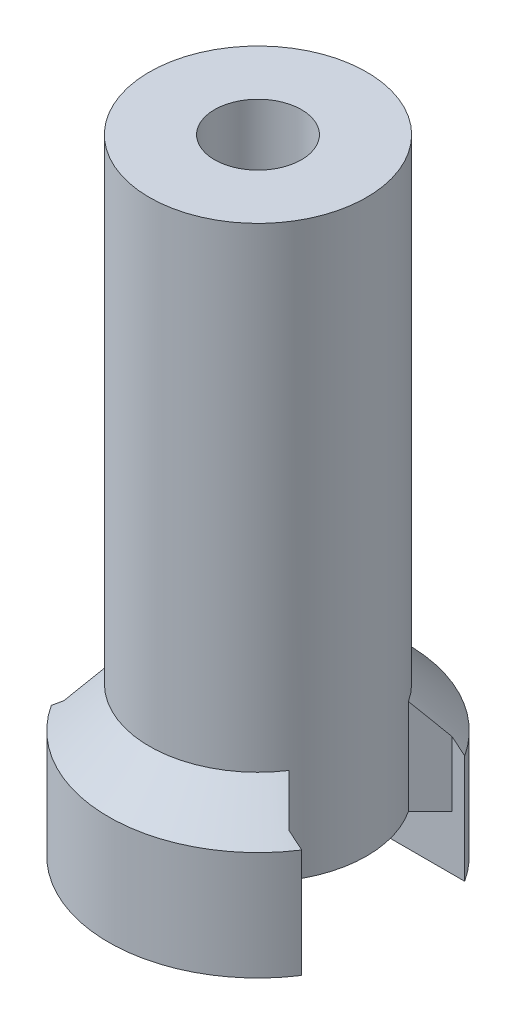
from build123d import *
from OCP.BRepFilletAPI import BRepFilletAPI_MakeChamfer

# Parameters (mm, degrees)
SKETCH1_R           = 4
SKETCH1_R_2         = 1.6
BOSS_EXTRUDE1_DEPTH = 23
SKETCH3_W           = 13.555932204
SKETCH3_H           = 6
SKETCH3_R           = 1.6
CUT_EXTRUDE1_DEPTH  = 2
BOSS_EXTRUDE2_DEPTH = 4
CHAMFER1_SIZE       = 1.5
CHAMFER1_SIZE_2     = 1.062746067


with BuildPart() as part:
    # Sketch1 → Boss-Extrude1 (new body)
    with BuildSketch(Plane(origin=(0, 0, 0), x_dir=(1, 0, 0), z_dir=(0, 1, 0))):
        with Locations(Location((0, 0, 0), (0, 0, 270))):
            Circle(SKETCH1_R)
        with Locations(Location((0, 0, 0), (0, 0, 270))):
            Circle(SKETCH1_R_2, mode=Mode.SUBTRACT)
    extrude(amount=BOSS_EXTRUDE1_DEPTH)

    # Sketch3 → Cut-Extrude1 (cut)
    with BuildSketch(Plane.XZ):
        Rectangle(SKETCH3_W, SKETCH3_H)
        with Locations(Location((0, 0, 0), (0, 0, 270))):
            Circle(SKETCH3_R, mode=Mode.SUBTRACT)
    extrude(amount=-CUT_EXTRUDE1_DEPTH, mode=Mode.SUBTRACT)

    # Sketch5 → Boss-Extrude2 (add)
    with BuildSketch(Plane.XZ):
        with BuildLine():
            Line((-4.609772229, 3), (4.609772229, 3))
            ThreePointArc((4.609772229, 3), (0, 5.5), (-4.609772229, 3))
        make_face()
        with BuildLine():
            Line((4.609772229, -3), (-4.609772229, -3))
            ThreePointArc((-4.609772229, -3), (0, -5.5), (4.609772229, -3))
        make_face()
    extrude(amount=-BOSS_EXTRUDE2_DEPTH)

    # Chamfer1
    chamfer1_edges_1 = [part.edges().sort_by_distance(p)[0] for p in [
        (2.645751311, 3, -3),
    ]]
    chamfer1_side_1 = [part.faces().sort_by_distance(p)[0] for p in [
        (2.667006232, 3, -3),
    ]]
    chamfer1_edges_2 = [part.edges().sort_by_distance(p)[0] for p in [
        (-2.645751311, 3, -3),
    ]]
    chamfer1_side_2 = [part.faces().sort_by_distance(p)[0] for p in [
        (-2.667006232, 3, -3),
    ]]
    chamfer1_edges_3 = [part.edges().sort_by_distance(p)[0] for p in [
        (2.645751311, 3, 3),
    ]]
    chamfer1_side_3 = [part.faces().sort_by_distance(p)[0] for p in [
        (2.667006232, 3, 3),
    ]]
    chamfer1_edges_4 = [part.edges().sort_by_distance(p)[0] for p in [
        (-2.645751311, 3, 3),
    ]]
    chamfer1_side_4 = [part.faces().sort_by_distance(p)[0] for p in [
        (-2.667006232, 3, 3),
    ]]
    chamfer1_edges_5 = [part.edges().sort_by_distance(p)[0] for p in [
        (1.414213562, 4, 3.741657387),
        (0, 4, -4),
    ]]
    chamfer1 = BRepFilletAPI_MakeChamfer(part.part.solid().wrapped)
    for e in chamfer1_edges_1:
        chamfer1.Add(CHAMFER1_SIZE - 0.0001, CHAMFER1_SIZE_2 - 0.0001, e.wrapped, chamfer1_side_1[0].wrapped)
    for e in chamfer1_edges_2:
        chamfer1.Add(CHAMFER1_SIZE - 0.0001, CHAMFER1_SIZE_2 - 0.0001, e.wrapped, chamfer1_side_2[0].wrapped)
    for e in chamfer1_edges_3:
        chamfer1.Add(CHAMFER1_SIZE - 0.0001, CHAMFER1_SIZE_2 - 0.0001, e.wrapped, chamfer1_side_3[0].wrapped)
    for e in chamfer1_edges_4:
        chamfer1.Add(CHAMFER1_SIZE - 0.0001, CHAMFER1_SIZE_2 - 0.0001, e.wrapped, chamfer1_side_4[0].wrapped)
    for e in chamfer1_edges_5:
        chamfer1.Add(CHAMFER1_SIZE - 0.0001, e.wrapped)
    add(Compound.cast(chamfer1.Shape()), mode=Mode.REPLACE)  # a hair under: the kernel refuses the full size


solid = part.part
